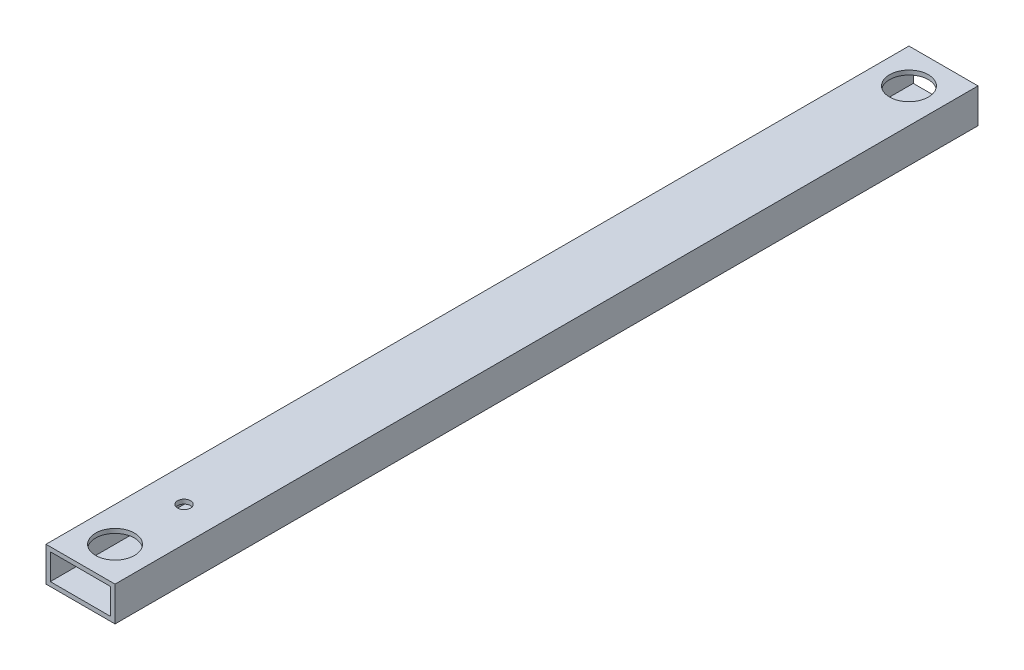
from build123d import *

# Parameters (mm, degrees)
SKETCH1_W           = 50.8
SKETCH1_H           = 25.4
BOSS_EXTRUDE1_DEPTH = 635
SKETCH2_W           = 44.45
SKETCH2_H           = 19.05
CUT_EXTRUDE1_DEPTH  = 635
SKETCH6_R           = 14.2875
CUT_EXTRUDE5_DEPTH  = 3.175
SKETCH7_R           = 14.2875
CUT_EXTRUDE6_DEPTH  = 3.175
SKETCH8_R           = 4.7625
CUT_EXTRUDE7_DEPTH  = 25.4


with BuildPart() as part:
    # Sketch1 → Boss-Extrude1 (new body)
    with BuildSketch(Plane.XY):
        with Locations((25.4, 12.7)):
            Rectangle(SKETCH1_W, SKETCH1_H)
    extrude(amount=BOSS_EXTRUDE1_DEPTH)

    # Sketch2 → Cut-Extrude1 (cut)
    with BuildSketch(Plane(origin=(0, 0, 0), x_dir=(-1, 0, 0), z_dir=(0, 0, -1))):
        with Locations((-25.4, 12.7)):
            Rectangle(SKETCH2_W, SKETCH2_H)
    extrude(amount=-CUT_EXTRUDE1_DEPTH, mode=Mode.SUBTRACT)

    # Sketch6 → Cut-Extrude5 (cut)
    with BuildSketch(Plane(origin=(0, 25.4, 0), x_dir=(1, 0, 0), z_dir=(0, 1, 0))):
        with Locations((25.4, -25.4)):
            Circle(SKETCH6_R)
    extrude(amount=-CUT_EXTRUDE5_DEPTH, mode=Mode.SUBTRACT)

    # Sketch7 → Cut-Extrude6 (cut)
    with BuildSketch(Plane(origin=(0, 25.4, 0), x_dir=(1, 0, 0), z_dir=(0, 1, 0))):
        with Locations((25.4, -609.6)):
            Circle(SKETCH7_R)
    extrude(amount=-CUT_EXTRUDE6_DEPTH, mode=Mode.SUBTRACT)

    # Sketch8 → Cut-Extrude7 (cut)
    with BuildSketch(Plane(origin=(0, 0, 0), x_dir=(-1, 0, 0), z_dir=(0, -1, 0))):
        with Locations((-25.4, -558.8)):
            Circle(SKETCH8_R)
    extrude(amount=-CUT_EXTRUDE7_DEPTH, mode=Mode.SUBTRACT)


solid = part.part
